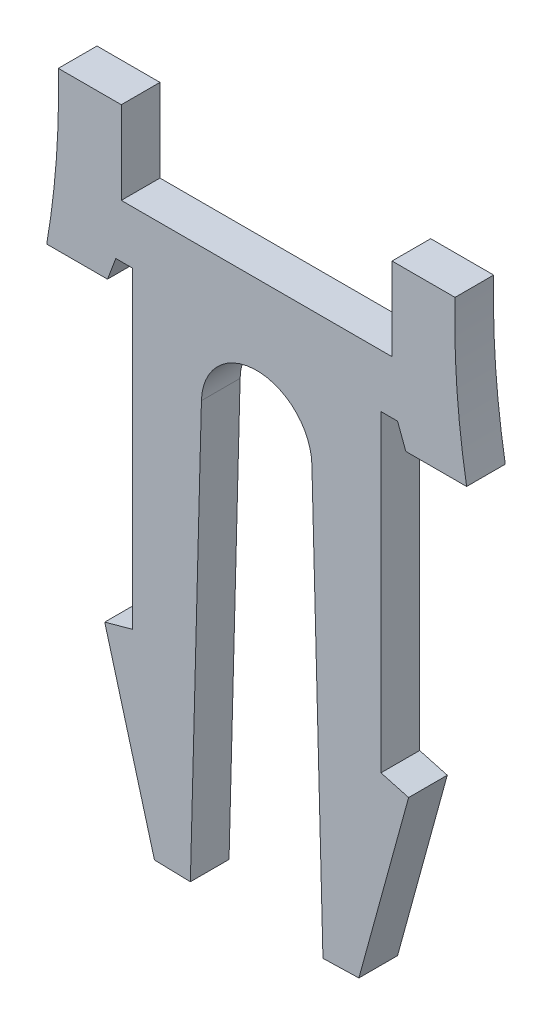
from build123d import *

# Parameters (mm, degrees)
BASE_FLANGE1_DEPTH = 0.35


# Sheet-metal steps are written as plain solids
with BuildPart() as part:
    # Sketch1 → Base-Flange1 (new body)
    with BuildSketch(Plane.XY):
        with BuildLine():
            Line((-0.499828266, 0.013103606), (-0.6, -3.807879902))
            Line((-0.6, -3.807879902), (-0.925, -3.799359631))
            Line((-0.925, -3.799359631), (-1.375, -2.16))
            Line((-1.375, -2.16), (-1.125, -2.091375643))
            Line((-1.125, -2.091375643), (-1.125, 0.74))
            Line((-1.125, 0.74), (-1.275, 0.74))
            Line((-1.275, 0.74), (-1.35, 0.54))
            Line((-1.35, 0.54), (-1.9, 0.54))
            ThreePointArc((-1.9, 0.54), (-1.812546359, 1.252433474), (-1.795, 1.97))
            Line((-1.795, 1.97), (-1.225, 1.97))
            Line((-1.225, 1.97), (-1.225, 1.22))
            Line((-1.225, 1.22), (1.225, 1.22))
            Line((1.225, 1.22), (1.225, 1.97))
            Line((1.225, 1.97), (1.795, 1.97))
            ThreePointArc((1.795, 1.97), (1.812546359, 1.252433474), (1.9, 0.54))
            Line((1.9, 0.54), (1.35, 0.54))
            Line((1.35, 0.54), (1.275, 0.74))
            Line((1.275, 0.74), (1.125, 0.74))
            Line((1.125, 0.74), (1.125, -2.091375643))
            Line((1.125, -2.091375643), (1.375, -2.16))
            Line((1.375, -2.16), (0.925, -3.799359631))
            Line((0.925, -3.799359631), (0.6, -3.807879902))
            Line((0.6, -3.807879902), (0.499828266, 0.013103606))
            ThreePointArc((0.499828266, 0.013103606), (0, 0.5), (-0.499828266, 0.013103606))
        make_face()
    extrude(amount=-BASE_FLANGE1_DEPTH)


solid = part.part
